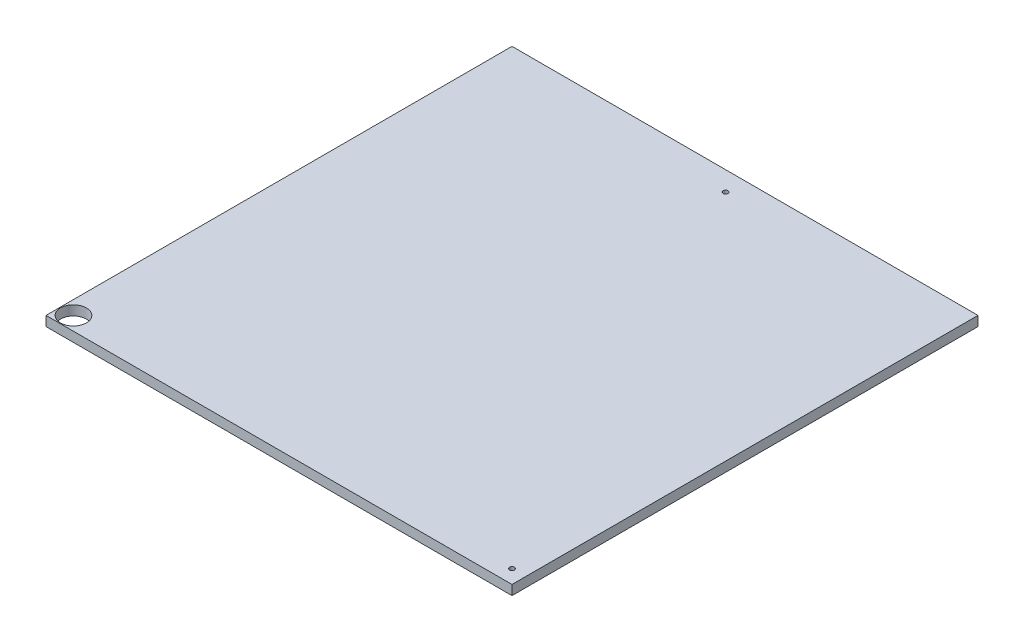
from build123d import *

# Parameters (mm, degrees)
SKETCH1_W           = 609.6
SKETCH1_H           = 609.6
BOSS_EXTRUDE1_DEPTH = 12.7
SKETCH5_R           = 3.175
CUT_EXTRUDE2_DEPTH  = 863.198126883
SKETCH7_R           = 17
CUT_EXTRUDE3_DEPTH  = 863.198126883


with BuildPart() as part:
    # Sketch1 → Boss-Extrude1 (new body)
    with BuildSketch(Plane(origin=(0, 0, 0), x_dir=(1, 0, 0), z_dir=(0, 1, 0))):
        with Locations((304.8, 304.8)):
            Rectangle(SKETCH1_W, SKETCH1_H)
    extrude(amount=BOSS_EXTRUDE1_DEPTH)

    # Sketch5 → Cut-Extrude2 (cut, through all)
    with BuildSketch(Plane(origin=(0, 12.7, 0), x_dir=(1, 0, 0), z_dir=(0, 1, 0))):
        with Locations((17.960512242, 17.960512242)):
            Circle(SKETCH5_R)
        with Locations((591.639487758, 17.960512242)):
            Circle(SKETCH5_R)
        with Locations((304.8, 584.2)):
            Circle(SKETCH5_R)
    extrude(amount=-CUT_EXTRUDE2_DEPTH, mode=Mode.SUBTRACT)

    # Sketch7 → Cut-Extrude3 (cut, through all)
    with BuildSketch(Plane(origin=(0, 12.7, 0), x_dir=(1, 0, 0), z_dir=(0, 1, 0))):
        with Locations((17.960512203, 17.96051187)):
            Circle(SKETCH7_R)
    extrude(amount=-CUT_EXTRUDE3_DEPTH, mode=Mode.SUBTRACT)


solid = part.part
